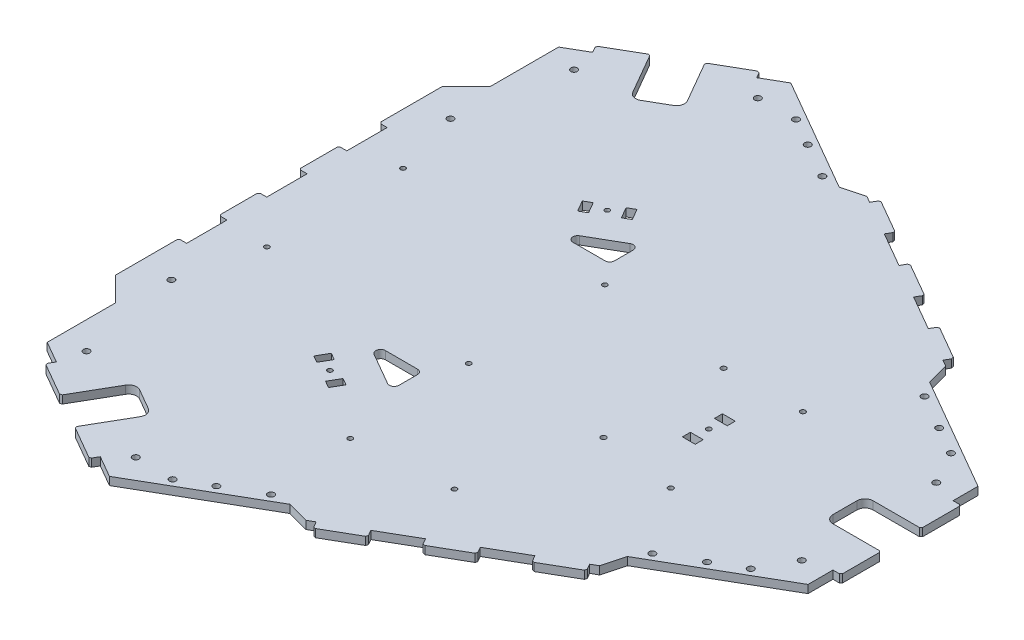
from build123d import *

# Parameters (mm, degrees)
STOCK_ACRYLIC_BASE_MASTER_1_START       = -20
STOCK_ACRYLIC_BASE_MASTER_1_OUTLINE_R   = 2
STOCK_ACRYLIC_BASE_MASTER_1_OUTLINE_R_2 = 1.5
STOCK_ACRYLIC_BASE_MASTER_1_OUTLINE_W   = 8
STOCK_ACRYLIC_BASE_MASTER_1_OUTLINE_H   = 5
STOCK_ACRYLIC_BASE_MASTER_1_DEPTH       = 5
SKETCH11_R                              = 1.5
BOSS_EXTRUDE3_DEPTH                     = 5
SKETCH2_R                               = 1.5
CUT_EXTRUDE2_DEPTH                      = 307.069355239
SKETCH6_W                               = 5
SKETCH6_H                               = 25.2
CUT_EXTRUDE6_DEPTH                      = 307.069355239
BOSS_EXTRUDE1_DEPTH                     = 5
BOSS_EXTRUDE2_DEPTH                     = 5
CHAMFER1_SIZE                           = 1
SKETCH9_R                               = 1.5999968
CUT_EXTRUDE7_DEPTH                      = 307.069355239
SKETCH4_R                               = 1.5
CUT_EXTRUDE4_DEPTH                      = 307.069355239
CUT_EXTRUDE8_DEPTH                      = 307.069355239


# Read off the part's stored shape, not the designer's step: Stock-acrylic-base-master-1
with BuildPart() as part:
    # Stock-acrylic-base-master-1 outline → Stock-acrylic-base-master-1 (new body)
    with BuildSketch(Plane(origin=(0, 0, 0), x_dir=(1, 0, 0), z_dir=(0, 1, 0)).offset(STOCK_ACRYLIC_BASE_MASTER_1_START)):
        with BuildLine():
            Line((143.52885683, -94.330127019), (215, -53.06624327))
            Line((215, -53.06624327), (215, -37.5))
            Line((215, -37.5), (220, -37.5))
            Line((220, -37.5), (220, -12.5))
            Line((220, -12.5), (190, -12.5))
            ThreePointArc((190, -12.5), (186.464466094, -11.035533906), (185, -7.5))
            Line((185, -7.5), (185, 7.5))
            ThreePointArc((185, 7.5), (186.464466094, 11.035533906), (190, 12.5))
            Line((190, 12.5), (220, 12.5))
            Line((220, 12.5), (220, 37.5))
            Line((220, 37.5), (215, 37.5))
            Line((215, 37.5), (215, 53.06624327))
            Line((215, 53.06624327), (143.52885683, 94.330127019))
            Line((143.52885683, 94.330127019), (139.868602792, 107.990381057))
            Line((139.868602792, 107.990381057), (23.588111964, 175.124953738))
            Line((23.588111964, 175.124953738), (9.927857926, 171.4646997))
            Line((9.927857926, 171.4646997), (-61.543285245, 212.728583449))
            Line((-61.543285245, 212.728583449), (-75.024047358, 204.945461814))
            Line((-75.024047358, 204.945461814), (-77.524047358, 209.275588833))
            Line((-77.524047358, 209.275588833), (-99.174682453, 196.775588833))
            Line((-99.174682453, 196.775588833), (-84.174682453, 170.794826719))
            ThreePointArc((-84.174682453, 170.794826719), (-83.67518034, 167.000731493), (-86.004809472, 163.9646997))
            Line((-86.004809472, 163.9646997), (-98.995190528, 156.4646997))
            ThreePointArc((-98.995190528, 156.4646997), (-102.789285753, 155.965197588), (-105.825317547, 158.294826719))
            Line((-105.825317547, 158.294826719), (-120.825317547, 184.275588833))
            Line((-120.825317547, 184.275588833), (-142.475952642, 171.775588833))
            Line((-142.475952642, 171.775588833), (-139.975952642, 167.445461814))
            Line((-139.975952642, 167.445461814), (-153.456714755, 159.662340179))
            Line((-153.456714755, 159.662340179), (-153.456714755, 117.134572681))
            Line((-153.456714755, 117.134572681), (-168.456714755, 102.134572681))
            Line((-168.456714755, 102.134572681), (-168.456714755, -102.134572681))
            Line((-168.456714755, -102.134572681), (-153.456714755, -117.134572681))
            Line((-153.456714755, -117.134572681), (-153.456714755, -159.662340179))
            Line((-153.456714755, -159.662340179), (-139.975952642, -167.445461814))
            Line((-139.975952642, -167.445461814), (-142.475952642, -171.775588833))
            Line((-142.475952642, -171.775588833), (-120.825317547, -184.275588833))
            Line((-120.825317547, -184.275588833), (-105.825317547, -158.294826719))
            ThreePointArc((-105.825317547, -158.294826719), (-102.789285753, -155.965197588), (-98.995190528, -156.4646997))
            Line((-98.995190528, -156.4646997), (-86.004809472, -163.9646997))
            ThreePointArc((-86.004809472, -163.9646997), (-83.67518034, -167.000731493), (-84.174682453, -170.794826719))
            Line((-84.174682453, -170.794826719), (-99.174682453, -196.775588833))
            Line((-99.174682453, -196.775588833), (-77.524047358, -209.275588833))
            Line((-77.524047358, -209.275588833), (-75.024047358, -204.945461814))
            Line((-75.024047358, -204.945461814), (-61.543285245, -212.728583449))
            Line((-61.543285245, -212.728583449), (9.927857926, -171.4646997))
            Line((9.927857926, -171.4646997), (23.588111964, -175.124953738))
            Line((23.588111964, -175.124953738), (139.868602792, -107.990381057))
            Line((139.868602792, -107.990381057), (143.52885683, -94.330127019))
        make_face()
        with Locations((-136.373066959, -152.205080757)):
            Circle(STOCK_ACRYLIC_BASE_MASTER_1_OUTLINE_R, mode=Mode.SUBTRACT)
        Polygon((-96.368272016, -106.974873734), (-92.83273811, -110.51040764), (-98.48959236, -116.16726189), (-102.025126266, -112.631727984), align=None, mode=Mode.SUBTRACT)
        with Locations((-63.626933041, -194.205080757)):
            Circle(STOCK_ACRYLIC_BASE_MASTER_1_OUTLINE_R, mode=Mode.SUBTRACT)
        with Locations((-40.203539282, -194.634572681)):
            Circle(STOCK_ACRYLIC_BASE_MASTER_1_OUTLINE_R, mode=Mode.SUBTRACT)
        with Locations((-22.883031207, -184.634572681)):
            Circle(STOCK_ACRYLIC_BASE_MASTER_1_OUTLINE_R, mode=Mode.SUBTRACT)
        with Locations((-1.232396112, -172.134572681)):
            Circle(STOCK_ACRYLIC_BASE_MASTER_1_OUTLINE_R, mode=Mode.SUBTRACT)
        with Locations((-148.456714755, -87.134572681)):
            Circle(STOCK_ACRYLIC_BASE_MASTER_1_OUTLINE_R, mode=Mode.SUBTRACT)
        Polygon((-106.974873734, -96.368272016), (-112.631727984, -102.025126266), (-116.16726189, -98.48959236), (-110.51040764, -92.83273811), align=None, mode=Mode.SUBTRACT)
        with Locations((-104.5, -104.5)):
            Circle(STOCK_ACRYLIC_BASE_MASTER_1_OUTLINE_R_2, mode=Mode.SUBTRACT)
        with Locations((-50, -86.602540378)):
            Circle(STOCK_ACRYLIC_BASE_MASTER_1_OUTLINE_R_2, mode=Mode.SUBTRACT)
        Polygon((-58.495190528, -86.316641994), (-62.825317547, -83.816641994), (-58.825317547, -76.888438763), (-54.495190528, -79.388438763), align=None, mode=Mode.SUBTRACT)
        Polygon((-41.174682453, -96.316641994), (-45.504809472, -93.816641994), (-41.504809472, -86.888438763), (-37.174682453, -89.388438763), align=None, mode=Mode.SUBTRACT)
        Polygon((96.368272016, -106.974873734), (102.025126266, -112.631727984), (98.48959236, -116.16726189), (92.83273811, -110.51040764), align=None, mode=Mode.SUBTRACT)
        with Locations((104.5, -104.5)):
            Circle(STOCK_ACRYLIC_BASE_MASTER_1_OUTLINE_R_2, mode=Mode.SUBTRACT)
        Polygon((106.974873734, -96.368272016), (110.51040764, -92.83273811), (116.16726189, -98.48959236), (112.631727984, -102.025126266), align=None, mode=Mode.SUBTRACT)
        with Locations((100, -10)):
            Rectangle(STOCK_ACRYLIC_BASE_MASTER_1_OUTLINE_W, STOCK_ACRYLIC_BASE_MASTER_1_OUTLINE_H, mode=Mode.SUBTRACT)
        with Locations((149.689110868, -85)):
            Circle(STOCK_ACRYLIC_BASE_MASTER_1_OUTLINE_R, mode=Mode.SUBTRACT)
        with Locations((171.339745962, -72.5)):
            Circle(STOCK_ACRYLIC_BASE_MASTER_1_OUTLINE_R, mode=Mode.SUBTRACT)
        with Locations((188.660254038, -62.5)):
            Circle(STOCK_ACRYLIC_BASE_MASTER_1_OUTLINE_R, mode=Mode.SUBTRACT)
        with Locations((200, -42)):
            Circle(STOCK_ACRYLIC_BASE_MASTER_1_OUTLINE_R, mode=Mode.SUBTRACT)
        with Locations((-148.456714755, 87.134572681)):
            Circle(STOCK_ACRYLIC_BASE_MASTER_1_OUTLINE_R, mode=Mode.SUBTRACT)
        Polygon((-106.974873734, 96.368272016), (-110.51040764, 92.83273811), (-116.16726189, 98.48959236), (-112.631727984, 102.025126266), align=None, mode=Mode.SUBTRACT)
        with Locations((-104.5, 104.5)):
            Circle(STOCK_ACRYLIC_BASE_MASTER_1_OUTLINE_R_2, mode=Mode.SUBTRACT)
        Polygon((-54.495190528, 79.388438763), (-58.825317547, 76.888438763), (-62.825317547, 83.816641994), (-58.495190528, 86.316641994), align=None, mode=Mode.SUBTRACT)
        with Locations((-50, 86.602540378)):
            Circle(STOCK_ACRYLIC_BASE_MASTER_1_OUTLINE_R_2, mode=Mode.SUBTRACT)
        Polygon((-37.174682453, 89.388438763), (-41.504809472, 86.888438763), (-45.504809472, 93.816641994), (-41.174682453, 96.316641994), align=None, mode=Mode.SUBTRACT)
        with Locations((-136.373066959, 152.205080757)):
            Circle(STOCK_ACRYLIC_BASE_MASTER_1_OUTLINE_R, mode=Mode.SUBTRACT)
        Polygon((-96.368272016, 106.974873734), (-102.025126266, 112.631727984), (-98.48959236, 116.16726189), (-92.83273811, 110.51040764), align=None, mode=Mode.SUBTRACT)
        with Locations((-22.883031207, 184.634572681)):
            Circle(STOCK_ACRYLIC_BASE_MASTER_1_OUTLINE_R, mode=Mode.SUBTRACT)
        with Locations((-63.626933041, 194.205080757)):
            Circle(STOCK_ACRYLIC_BASE_MASTER_1_OUTLINE_R, mode=Mode.SUBTRACT)
        with Locations((-40.203539282, 194.634572681)):
            Circle(STOCK_ACRYLIC_BASE_MASTER_1_OUTLINE_R, mode=Mode.SUBTRACT)
        with Locations((-1.232396112, 172.134572681)):
            Circle(STOCK_ACRYLIC_BASE_MASTER_1_OUTLINE_R, mode=Mode.SUBTRACT)
        with Locations((100, 0)):
            Circle(STOCK_ACRYLIC_BASE_MASTER_1_OUTLINE_R_2, mode=Mode.SUBTRACT)
        with Locations((100, 10)):
            Rectangle(STOCK_ACRYLIC_BASE_MASTER_1_OUTLINE_W, STOCK_ACRYLIC_BASE_MASTER_1_OUTLINE_H, mode=Mode.SUBTRACT)
        with Locations((104.5, 104.5)):
            Circle(STOCK_ACRYLIC_BASE_MASTER_1_OUTLINE_R_2, mode=Mode.SUBTRACT)
        Polygon((106.974873734, 96.368272016), (112.631727984, 102.025126266), (116.16726189, 98.48959236), (110.51040764, 92.83273811), align=None, mode=Mode.SUBTRACT)
        with Locations((200, 42)):
            Circle(STOCK_ACRYLIC_BASE_MASTER_1_OUTLINE_R, mode=Mode.SUBTRACT)
        with Locations((171.339745962, 72.5)):
            Circle(STOCK_ACRYLIC_BASE_MASTER_1_OUTLINE_R, mode=Mode.SUBTRACT)
        with Locations((149.689110868, 85)):
            Circle(STOCK_ACRYLIC_BASE_MASTER_1_OUTLINE_R, mode=Mode.SUBTRACT)
        with Locations((188.660254038, 62.5)):
            Circle(STOCK_ACRYLIC_BASE_MASTER_1_OUTLINE_R, mode=Mode.SUBTRACT)
        Polygon((96.368272016, 106.974873734), (92.83273811, 110.51040764), (98.48959236, 116.16726189), (102.025126266, 112.631727984), align=None, mode=Mode.SUBTRACT)
    extrude(amount=STOCK_ACRYLIC_BASE_MASTER_1_DEPTH)

    # Sketch11 → Boss-Extrude3 (add)
    with BuildSketch(Plane.XZ.offset(20)):
        with Locations((-104.5, 104.5)):
            Circle(SKETCH11_R)
        with Locations((-104.5, -104.5)):
            Circle(SKETCH11_R)
        with Locations((104.5, -104.5)):
            Circle(SKETCH11_R)
        with Locations((104.5, 104.5)):
            Circle(SKETCH11_R)
        Polygon((-106.974873734, 96.368272016), (-112.631727984, 102.025126266), (-116.16726189, 98.48959236), (-110.51040764, 92.83273811), align=None)
        Polygon((-96.368272016, 106.974873734), (-92.83273811, 110.51040764), (-98.48959236, 116.16726189), (-102.025126266, 112.631727984), align=None)
        Polygon((-106.974873734, -96.368272016), (-110.51040764, -92.83273811), (-116.16726189, -98.48959236), (-112.631727984, -102.025126266), align=None)
        Polygon((-96.368272016, -106.974873734), (-102.025126266, -112.631727984), (-98.48959236, -116.16726189), (-92.83273811, -110.51040764), align=None)
        Polygon((96.368272016, -106.974873734), (92.83273811, -110.51040764), (98.48959236, -116.16726189), (102.025126266, -112.631727984), align=None)
        Polygon((106.974873734, -96.368272016), (112.631727984, -102.025126266), (116.16726189, -98.48959236), (110.51040764, -92.83273811), align=None)
        Polygon((106.974873734, 96.368272016), (110.51040764, 92.83273811), (116.16726189, 98.48959236), (112.631727984, 102.025126266), align=None)
        Polygon((96.368272016, 106.974873734), (102.025126266, 112.631727984), (98.48959236, 116.16726189), (92.83273811, 110.51040764), align=None)
    extrude(amount=-BOSS_EXTRUDE3_DEPTH)

    # Sketch2 → Cut-Extrude2 (cut, through all)
    with BuildSketch(Plane(origin=(0, -15, 0), x_dir=(1, 0, 0), z_dir=(0, 1, 0))):
        with Locations(Location((-10.456714755, 45.5, 0), (0, 0, 270))):
            Circle(SKETCH2_R)
        with Locations(Location((-10.456714755, -39.5, 0), (0, 0, 270))):
            Circle(SKETCH2_R)
        with Locations(Location((-136.456714755, -39.5, 0), (0, 0, 270))):
            Circle(SKETCH2_R)
        with Locations(Location((-136.456714755, 45.5, 0), (0, 0, 270))):
            Circle(SKETCH2_R)
    extrude(amount=-CUT_EXTRUDE2_DEPTH, mode=Mode.SUBTRACT)

    # Sketch6 → Cut-Extrude6 (cut, through all)
    with BuildSketch(Plane(origin=(0, -15, 0), x_dir=(1, 0, 0), z_dir=(0, 1, 0))):
        with Locations((-165.956714755, 0)):
            Rectangle(SKETCH6_W, SKETCH6_H)
        with Locations((-165.956714755, 50)):
            Rectangle(SKETCH6_W, SKETCH6_H)
        with Locations((-165.956714755, -50)):
            Rectangle(SKETCH6_W, SKETCH6_H)
    extrude(amount=-CUT_EXTRUDE6_DEPTH, mode=Mode.SUBTRACT)

    # Sketch7 → Boss-Extrude1 (add)
    with BuildSketch(Plane(origin=(0, -15, 0), x_dir=(1, 0, 0), z_dir=(0, 1, 0))):
        Polygon((92.553674925, 135.307667397), (95.053674925, 139.637794416), (73.40303983, 152.137794416), (70.90303983, 147.807667397), align=None)
        Polygon((114.20431002, 122.807667397), (116.70431002, 127.137794416), (138.354945114, 114.637794416), (135.854945114, 110.307667397), align=None)
        Polygon((49.252404736, 160.307667397), (51.752404736, 164.637794416), (30.101769641, 177.137794416), (27.601769641, 172.807667397), align=None)
    extrude(amount=-BOSS_EXTRUDE1_DEPTH)

    # Sketch8 → Boss-Extrude2 (add)
    with BuildSketch(Plane(origin=(0, -15, 0), x_dir=(1, 0, 0), z_dir=(0, 1, 0))):
        Polygon((92.553674925, -135.307667397), (95.053674925, -139.637794416), (73.40303983, -152.137794416), (70.90303983, -147.807667397), align=None)
        Polygon((49.252404736, -160.307667397), (51.752404736, -164.637794416), (30.101769641, -177.137794416), (27.601769641, -172.807667397), align=None)
        Polygon((114.20431002, -122.807667397), (116.70431002, -127.137794416), (138.354945114, -114.637794416), (135.854945114, -110.307667397), align=None)
    extrude(amount=-BOSS_EXTRUDE2_DEPTH)

    # Chamfer1
    chamfer1_edges = [part.edges().sort_by_distance(p)[0] for p in [
        (-168.456714755, -17.5, 12.6),
        (-168.456714755, -17.5, -12.6),
        (-168.456714755, -17.5, -37.4),
        (-168.456714755, -17.5, -62.6),
        (-168.456714755, -17.5, 62.6),
        (-168.456714755, -17.5, 37.4),
        (220, -17.5, 37.5),
        (220, -17.5, 12.5),
        (95.053674925, -17.5, -139.637794416),
        (73.40303983, -17.5, -152.137794416),
        (138.354945114, -17.5, -114.637794416),
        (116.70431002, -17.5, -127.137794416),
        (51.752404736, -17.5, -164.637794416),
        (30.101769641, -17.5, -177.137794416),
        (73.40303983, -17.5, 152.137794416),
        (95.053674925, -17.5, 139.637794416),
        (30.101769641, -17.5, 177.137794416),
        (51.752404736, -17.5, 164.637794416),
        (116.70431002, -17.5, 127.137794416),
        (138.354945114, -17.5, 114.637794416),
        (220, -17.5, -12.5),
        (220, -17.5, -37.5),
        (-77.524047358, -17.5, -209.275588833),
        (-99.174682453, -17.5, -196.775588833),
        (-142.475952642, -17.5, -171.775588833),
        (-120.825317547, -17.5, -184.275588833),
        (-142.475952642, -17.5, 171.775588833),
        (-120.825317547, -17.5, 184.275588833),
        (-77.524047358, -17.5, 209.275588833),
        (-99.174682453, -17.5, 196.775588833),
    ]]
    chamfer(chamfer1_edges, length=CHAMFER1_SIZE)

    # Sketch9 → Cut-Extrude7 (cut, through all)
    with BuildSketch(Plane.XZ.offset(20)):
        with Locations(Location((120, -38.735, 0), (0, 0, 270))):
            Circle(SKETCH9_R)
        with Locations(Location((71.74, 37.465, 0), (0, 0, 270))):
            Circle(SKETCH9_R)
        with Locations(Location((71.74, -37.465, 0), (0, 0, 270))):
            Circle(SKETCH9_R)
        with Locations(Location((120, 43.815, 0), (0, 0, 270))):
            Circle(SKETCH9_R)
    extrude(amount=-CUT_EXTRUDE7_DEPTH, mode=Mode.SUBTRACT)

    # Sketch4 → Cut-Extrude4 (cut, through all)
    with BuildSketch(Plane.XZ.offset(20)):
        with Locations(Location((53.06810334, 111.916651246, 0), (0, 0, 270))):
            Circle(SKETCH4_R)
        with Locations(Location((-6.880281166, 117.083003449, 0), (0, 0, 270))):
            Circle(SKETCH4_R)
    extrude(amount=-CUT_EXTRUDE4_DEPTH, mode=Mode.SUBTRACT)

    # Sketch10 → Cut-Extrude8 (cut, through all)
    with BuildSketch(Plane(origin=(0, -20, 0), x_dir=(-1, 0, 0), z_dir=(0, -1, 0))):
        with BuildLine():
            Line((43.392304845, 58.549981495), (23.392304845, 58.549981495))
            ThreePointArc((23.392304845, 58.549981495), (21.270984502, 59.428661152), (20.392304845, 61.549981495))
            Line((20.392304845, 61.549981495), (20.392304845, 73.096986879))
            ThreePointArc((20.392304845, 73.096986879), (21.892304845, 75.69506309), (24.892304845, 75.69506309))
            Line((24.892304845, 75.69506309), (44.892304845, 64.148057707))
            ThreePointArc((44.892304845, 64.148057707), (46.290082324, 60.77352436), (43.392304845, 58.549981495))
        make_face()
        with BuildLine():
            Line((24.892304845, -75.69506309), (44.892304845, -64.148057707))
            ThreePointArc((44.892304845, -64.148057707), (46.290082324, -60.77352436), (43.392304845, -58.549981495))
            Line((43.392304845, -58.549981495), (23.392304845, -58.549981495))
            ThreePointArc((23.392304845, -58.549981495), (21.270984502, -59.428661152), (20.392304845, -61.549981495))
            Line((20.392304845, -61.549981495), (20.392304845, -73.096986879))
            ThreePointArc((20.392304845, -73.096986879), (21.892304845, -75.69506309), (24.892304845, -75.69506309))
        make_face()
    extrude(amount=-CUT_EXTRUDE8_DEPTH, mode=Mode.SUBTRACT)


solid = part.part
